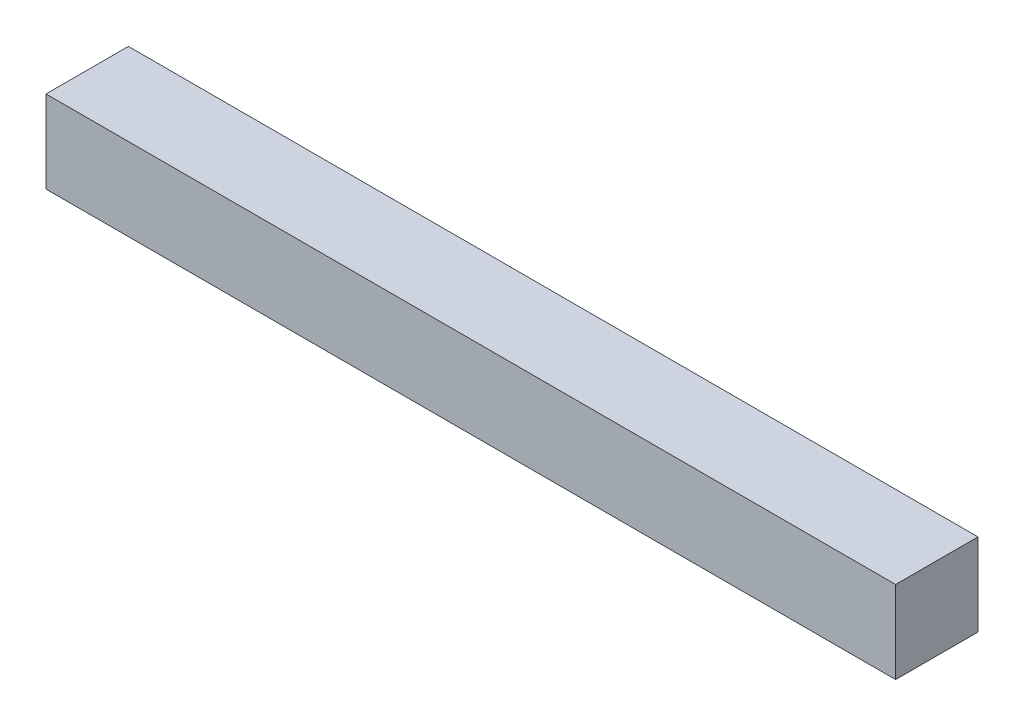
from build123d import *

# Parameters (mm, degrees)
SKETCH2_W             = 3.2
SKETCH2_H             = 3.2
BOSS_EXTRUDE1_DEPTH   = 33
BODY_MOVE_COPY1_ANGLE = 90


with BuildPart() as part:
    # Sketch2 → Boss-Extrude1 (new body)
    with BuildSketch(Plane(origin=(0, 0, 0), x_dir=(1, 0, 0), z_dir=(0, 1, 0))):
        Rectangle(SKETCH2_W, SKETCH2_H)
    extrude(amount=BOSS_EXTRUDE1_DEPTH)


with BuildPart() as part_1:
    # Body-Move/Copy1: moved
    add(part.part.rotate(Axis((0, 33, 0), (0, 0, 1)), BODY_MOVE_COPY1_ANGLE))


with BuildPart() as part_2:
    # Body-Move/Copy3: read off the stored shape, not the designer's step
    # Body-Move/Copy3: moved
    add(part_1.part.moved(Location((0, -33, 0))))


solid = part_2.part
